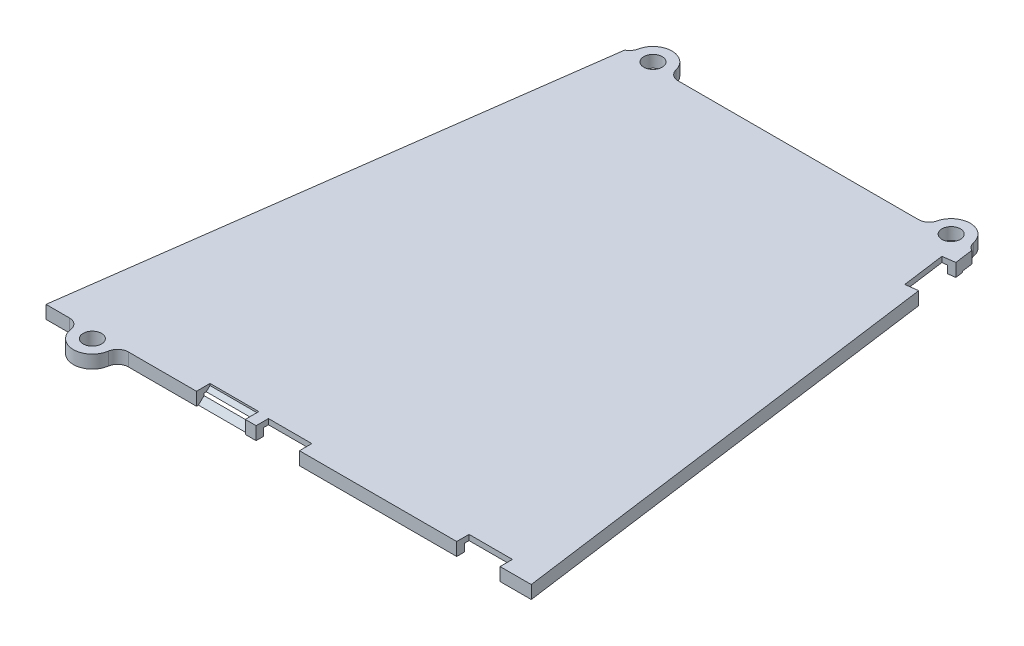
from build123d import *
from build123d.topology import SkipClean

# Parameters (mm, degrees)
EXTRUDE_1_DEPTH     = 1
EXTRUDE_2_DEPTH     = 1.4
EXTRUDE_3_DEPTH     = 2.4
CUT_EXTRUDE_2_REACH = 134.888
SKETCH_4_R          = 1.7
CUT_EXTRUDE_3_DEPTH = 10
CUT_EXTRUDE_4_REACH = 134.874
SKETCH_6_W          = 6.2
SKETCH_6_H          = 0.2
FILLET_START        = -1.2
FILLET_1_DEPTH      = 2.2
FILLET_START_2      = -1.4
FILLET_1_2_DEPTH    = 0.226512
SKETCH_7_W          = 9
SKETCH_7_H          = 2.5
CUT_EXTRUDE_5_DEPTH = 133.88811083
EXTRUDE_4_REACH     = 113.48


with BuildPart() as part:
    # 草图1 → 凸台-拉伸1 (new body)
    with BuildSketch(Plane(origin=(0, 0, 0), x_dir=(1, 0, 0), z_dir=(0, 1, 0))):
        Polygon((0, 0), (12.75, 94), (76.75, 94), (89.5, 0), align=None)
    extrude(amount=EXTRUDE_1_DEPTH)

    # 草图2 → 凸台-拉伸2 (add)
    with BuildSketch(Plane.XZ):
        Polygon((89.5, 0), (0, 0), (12.75, -94), (76.75, -94), align=None)
        Polygon((87.897286654, -1.4), (1.602713346, -1.4), (13.972926112, -92.6), (75.527073888, -92.6), align=None, mode=Mode.SUBTRACT)
    extrude(amount=EXTRUDE_2_DEPTH)

    # 草图3 → 凸台-拉伸3 (add)
    with BuildSketch(Plane(origin=(0, 1, 0), x_dir=(1, 0, 0), z_dir=(0, 1, 0))):
        with BuildLine():
            Line((6.25, -1.2), (6.25, 0))
            Line((6.25, 0), (8.545840542, 0))
            ThreePointArc((8.545840542, 0), (9.75, -2.9), (10.954159458, 0))
            Line((10.954159458, 0), (13.25, 0))
            Line((13.25, 0), (13.25, -1.2))
            ThreePointArc((13.25, -1.2), (9.75, -4.7), (6.25, -1.2))
        make_face()
        with BuildLine():
            Line((13.75, 94.7), (13.75, 94))
            Line((13.75, 94), (13.82071436, 94))
            Line((13.82071436, 94), (15.700806662, 94))
            ThreePointArc((15.700806662, 94), (17.25, 96.4), (18.799193338, 94))
            Line((18.799193338, 94), (20.75, 94))
            Line((20.75, 94), (20.75, 94.7))
            ThreePointArc((20.75, 94.7), (17.25, 98.2), (13.75, 94.7))
        make_face()
        with BuildLine():
            Line((68.75, 94.7), (68.75, 94))
            Line((68.75, 94), (70.700806662, 94))
            ThreePointArc((70.700806662, 94), (72.25, 96.4), (73.799193338, 94))
            Line((73.799193338, 94), (75.75, 94))
            Line((75.75, 94), (75.75, 94.7))
            ThreePointArc((75.75, 94.7), (72.25, 98.2), (68.75, 94.7))
        make_face()
    extrude(amount=-EXTRUDE_3_DEPTH)

    # 草图4 → 切除-拉伸2 (cut, up to next)
    with BuildSketch(Plane(origin=(0, 1, 0), x_dir=(1, 0, 0), z_dir=(0, 1, 0)), mode=Mode.PRIVATE) as cut_extrude_2_sk1:
        with Locations(Location((9.75, -1.2, 0), (0, 0, 270))):
            Circle(SKETCH_4_R)
    cut_extrude_2_tool1 = extrude(cut_extrude_2_sk1.sketch, amount=-CUT_EXTRUDE_2_REACH, mode=Mode.PRIVATE) & part.part
    # 草图4 → 切除-拉伸2 (cut, up to next)
    with BuildSketch(Plane(origin=(0, 1, 0), x_dir=(1, 0, 0), z_dir=(0, 1, 0)), mode=Mode.PRIVATE) as cut_extrude_2_sk2:
        with Locations(Location((17.25, 94.7, 0), (0, 0, 270))):
            Circle(SKETCH_4_R)
    cut_extrude_2_tool2 = extrude(cut_extrude_2_sk2.sketch, amount=-CUT_EXTRUDE_2_REACH, mode=Mode.PRIVATE) & part.part
    # 草图4 → 切除-拉伸2 (cut, up to next)
    with BuildSketch(Plane(origin=(0, 1, 0), x_dir=(1, 0, 0), z_dir=(0, 1, 0)), mode=Mode.PRIVATE) as cut_extrude_2_sk3:
        with Locations(Location((72.25, 94.7, 0), (0, 0, 270))):
            Circle(SKETCH_4_R)
    cut_extrude_2_tool3 = extrude(cut_extrude_2_sk3.sketch, amount=-CUT_EXTRUDE_2_REACH, mode=Mode.PRIVATE) & part.part
    add(cut_extrude_2_tool1.solids().sort_by_distance((9.75, 1, 1.2))[0], mode=Mode.SUBTRACT)
    add(cut_extrude_2_tool2.solids().sort_by_distance((17.25, 1, -94.7))[0], mode=Mode.SUBTRACT)
    add(cut_extrude_2_tool3.solids().sort_by_distance((72.25, 1, -94.7))[0], mode=Mode.SUBTRACT)

    # 草图5 → 切除-拉伸3 (cut)
    with SkipClean():  # the faces are left unmerged after this step: merging them gives an invalid solid
        with BuildSketch(Plane(origin=(0, 1, 0), x_dir=(1, 0, 0), z_dir=(0, 1, 0))):
            with BuildLine():
                Line((78.21236986, 90.741242548), (74.942313599, 90.297697683))
                Line((74.942313599, 90.297697683), (76.017573878, 82.370288564))
                Line((76.017573878, 82.370288564), (79.28763014, 82.81383343))
                ThreePointArc((79.28763014, 82.81383343), (82.713704559, 87.315168128), (78.21236986, 90.741242548))
            make_face()
            with BuildLine():
                Line((38.75, -1.222462011), (38.75, 2.277537989))
                Line((38.75, 2.277537989), (46.75, 2.277537989))
                Line((46.75, 2.277537989), (46.75, -1.222462011))
                ThreePointArc((46.75, -1.222462011), (42.75, -5.222462011), (38.75, -1.222462011))
            make_face()
            with BuildLine():
                Line((75.75, -1.222462011), (75.75, 2.277537989))
                Line((75.75, 2.277537989), (83.75, 2.277537989))
                Line((83.75, 2.277537989), (83.75, -1.222462011))
                ThreePointArc((83.75, -1.222462011), (79.75, -5.222462011), (75.75, -1.222462011))
            make_face()
        extrude(amount=-CUT_EXTRUDE_3_DEPTH, mode=Mode.SUBTRACT)

    # 草图6 → 切除-拉伸4 (cut, up to next)
    with BuildSketch(Plane(origin=(0, 0, 0), x_dir=(0, 0, -1), z_dir=(1, 0, 0)), mode=Mode.PRIVATE) as cut_extrude_4_sk1:
        with Locations((95.1, -1.3)):
            Rectangle(SKETCH_6_W, SKETCH_6_H)
    cut_extrude_4_tool1 = extrude(cut_extrude_4_sk1.sketch, amount=CUT_EXTRUDE_4_REACH, mode=Mode.PRIVATE) & part.part
    add(cut_extrude_4_tool1.solids().sort_by_distance((0, -1.3, -95.1))[0], mode=Mode.SUBTRACT)

    # 圆角1: read off the stored shape, not the designer's step
    # 圆角1 outline → 圆角1 (add)
    with SkipClean():  # the faces are left unmerged after this step: merging them gives an invalid solid
        with BuildSketch(Plane(origin=(0, 0, 0), x_dir=(1, 0, 0), z_dir=(0, 1, 0)).offset(FILLET_START)):
            with BuildLine():
                ThreePointArc((13.25, -1.2), (13.240681915, -1.455224942), (13.212777274, -1.709090909))
                ThreePointArc((13.212777274, -1.709090909), (13.884185107, -0.486425063), (15.191507144, 0))
                Line((15.191507144, 0), (13.25, 0))
                Line((13.25, 0), (13.25, -1.2))
            make_face()
            with BuildLine():
                ThreePointArc((4.308492856, 0), (5.615814893, -0.486425063), (6.287222726, -1.709090909))
                ThreePointArc((6.287222726, -1.709090909), (6.259318085, -1.455224942), (6.25, -1.2))
                Line((6.25, -1.2), (6.25, 0))
                Line((6.25, 0), (4.308492856, 0))
            make_face()
            with BuildLine():
                Line((75.75, 94), (76.75, 94))
                ThreePointArc((76.75, 94), (76.053957158, 94.573295448), (75.680491288, 95.394067374))
                ThreePointArc((75.680491288, 95.394067374), (75.732579469, 95.048769616), (75.75, 94.7))
                Line((75.75, 94.7), (75.75, 94))
            make_face()
            with BuildLine():
                ThreePointArc((13.75, 94.7), (13.767420531, 95.048769616), (13.819508712, 95.394067374))
                ThreePointArc((13.819508712, 95.394067374), (13.446042842, 94.573295448), (12.75, 94))
                Line((12.75, 94), (13.75, 94))
                Line((13.75, 94), (13.75, 94.7))
            make_face()
            with BuildLine():
                Line((20.75, 94), (22.594155686, 94))
                ThreePointArc((22.594155686, 94), (21.358326925, 94.427509214), (20.650826346, 95.527272727))
                ThreePointArc((20.650826346, 95.527272727), (20.725118143, 95.116598001), (20.75, 94.7))
                Line((20.75, 94.7), (20.75, 94))
            make_face()
            with BuildLine():
                ThreePointArc((68.75, 94.7), (68.774881857, 95.116598001), (68.849173654, 95.527272727))
                ThreePointArc((68.849173654, 95.527272727), (68.141673075, 94.427509214), (66.905844314, 94))
                Line((66.905844314, 94), (68.75, 94))
                Line((68.75, 94), (68.75, 94.7))
            make_face()
        extrude(amount=FILLET_1_DEPTH)

    # Fillet 1 2 outline → Fillet 1 2 (add)
    with SkipClean():  # the faces are left unmerged after this step: merging them gives an invalid solid
        with BuildSketch(Plane(origin=(0, 0, 0), x_dir=(1, 0, 0), z_dir=(0, 1, 0)).offset(FILLET_START_2)):
            with BuildLine():
                ThreePointArc((13.25, -1.2), (13.240681915, -1.455224942), (13.212777274, -1.709090909))
                ThreePointArc((13.212777274, -1.709090909), (13.884185107, -0.486425063), (15.191507144, 0))
                Line((15.191507144, 0), (13.25, 0))
                Line((13.25, 0), (13.25, -1.2))
            make_face()
            with BuildLine():
                ThreePointArc((4.308492856, 0), (5.615814893, -0.486425063), (6.287222726, -1.709090909))
                ThreePointArc((6.287222726, -1.709090909), (6.259318085, -1.455224942), (6.25, -1.2))
                Line((6.25, -1.2), (6.25, 0))
                Line((6.25, 0), (4.308492856, 0))
            make_face()
        extrude(amount=FILLET_1_2_DEPTH)

    # 草图7 → 切除-拉伸5 (cut, through all)
    with SkipClean():  # the faces are left unmerged after this step: merging them gives an invalid solid
        with BuildSketch(Plane(origin=(0, 1, 0), x_dir=(1, 0, 0), z_dir=(0, 1, 0))):
            with Locations((32.25, 1.25)):
                Rectangle(SKETCH_7_W, SKETCH_7_H)
        extrude(amount=-CUT_EXTRUDE_5_DEPTH, mode=Mode.SUBTRACT)

    # 草图8 → 凸台-拉伸4 (add, up to next)
    with BuildSketch(Plane.ZY.offset(-36.75), mode=Mode.PRIVATE) as extrude_4_sk1:
        Polygon((-2.5, 0.653445531), (-1.819327572, 0), (-2.5, 0), align=None)
    extrude_4_tool1 = extrude(extrude_4_sk1.sketch, amount=EXTRUDE_4_REACH, mode=Mode.PRIVATE) - part.part
    # 草图8 → 凸台-拉伸4 (add, up to next)
    with BuildSketch(Plane.ZY.offset(-36.75), mode=Mode.PRIVATE) as extrude_4_sk2:
        Polygon((-0.360994239, -1.4), (-1.4, -1.4), (-1.4, -0.402554469), align=None)
    extrude_4_tool2 = extrude(extrude_4_sk2.sketch, amount=EXTRUDE_4_REACH, mode=Mode.PRIVATE) - part.part
    add(extrude_4_tool1.solids().sort_by_distance((36.75, 0.217815, -2.273109))[0])
    add(extrude_4_tool2.solids().sort_by_distance((36.75, -1.067518, -1.053665))[0])


solid = part.part
